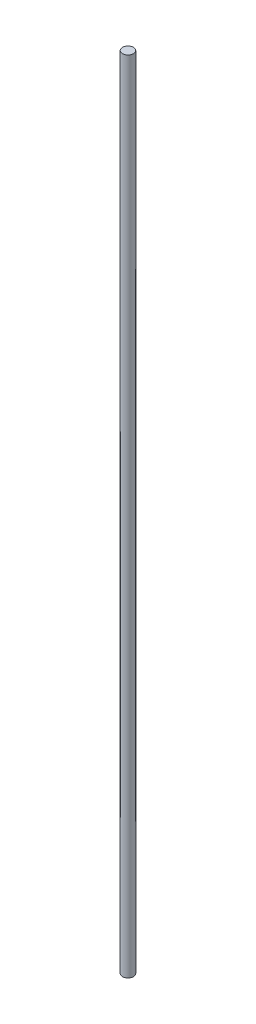
from build123d import *

# Parameters (mm, degrees)
SKETCH1_R           = 1.397
BOSS_EXTRUDE1_DEPTH = 203.2


with BuildPart() as part:
    # Sketch1 → Boss-Extrude1 (new body)
    with BuildSketch(Plane(origin=(0, 0, 0), x_dir=(1, 0, 0), z_dir=(0, 1, 0))):
        Circle(SKETCH1_R)
    extrude(amount=BOSS_EXTRUDE1_DEPTH)


solid = part.part
